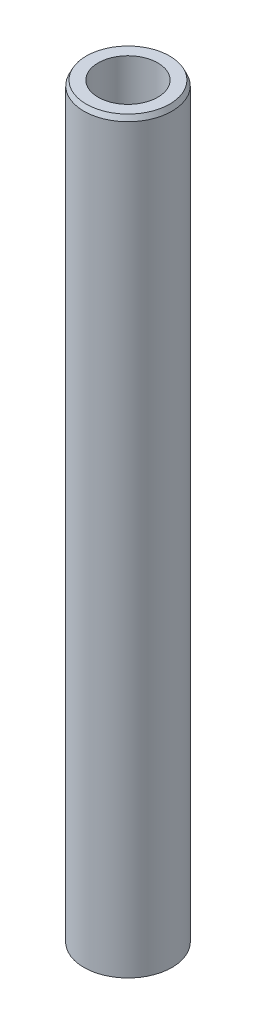
from build123d import *
from OCP.BRepFilletAPI import BRepFilletAPI_MakeChamfer

# Parameters (mm, degrees)
SKETCH1_R           = 32.5
BOSS_EXTRUDE1_DEPTH = 552.394427353
SKETCH2_R           = 21.989907453
CUT_EXTRUDE1_DEPTH  = 555.30325939
CHAMFER1_SIZE       = 3.644155671
CHAMFER1_SIZE2      = 1.735712213


with BuildPart() as part:
    # Sketch1 → Boss-Extrude1 (new body)
    with BuildSketch(Plane(origin=(0, 0, 0), x_dir=(1, 0, 0), z_dir=(0, 1, 0))):
        Circle(SKETCH1_R)
    extrude(amount=BOSS_EXTRUDE1_DEPTH)

    # Sketch2 → Cut-Extrude1 (cut, through all)
    with BuildSketch(Plane(origin=(0, 0, 0), x_dir=(1, 0, 0), z_dir=(0, 1, 0))):
        Circle(SKETCH2_R)
    extrude(amount=CUT_EXTRUDE1_DEPTH, mode=Mode.SUBTRACT)

    # Chamfer1: one chamfer whose edges measure the first distance from different faces: ONE call of the kernel's chamfer builder (chamfer() names one face for all edges)
    chamfer1_edges_1 = [part.edges().sort_by_distance(p)[0] for p in [
        (-32.5, 552.394427353, 0),
    ]]
    chamfer1_side_1 = [part.faces().sort_by_distance(p)[0] for p in [
        (-32.5, 276.197213677, 0),
    ]]
    chamfer1_edges_2 = [part.edges().sort_by_distance(p)[0] for p in [
        (-32.5, 0, 0),
    ]]
    chamfer1_side_2 = [part.faces().sort_by_distance(p)[0] for p in [
        (-31.580761184, 0, 0),
    ]]
    chamfer1 = BRepFilletAPI_MakeChamfer(part.part.solid().wrapped)
    for e in chamfer1_edges_1:
        chamfer1.Add(CHAMFER1_SIZE, CHAMFER1_SIZE2, e.wrapped, chamfer1_side_1[0].wrapped)  # the first distance lies on this face
    for e in chamfer1_edges_2:
        chamfer1.Add(CHAMFER1_SIZE, CHAMFER1_SIZE2, e.wrapped, chamfer1_side_2[0].wrapped)  # the first distance lies on this face
    add(Compound.cast(chamfer1.Shape()), mode=Mode.REPLACE)


solid = part.part
